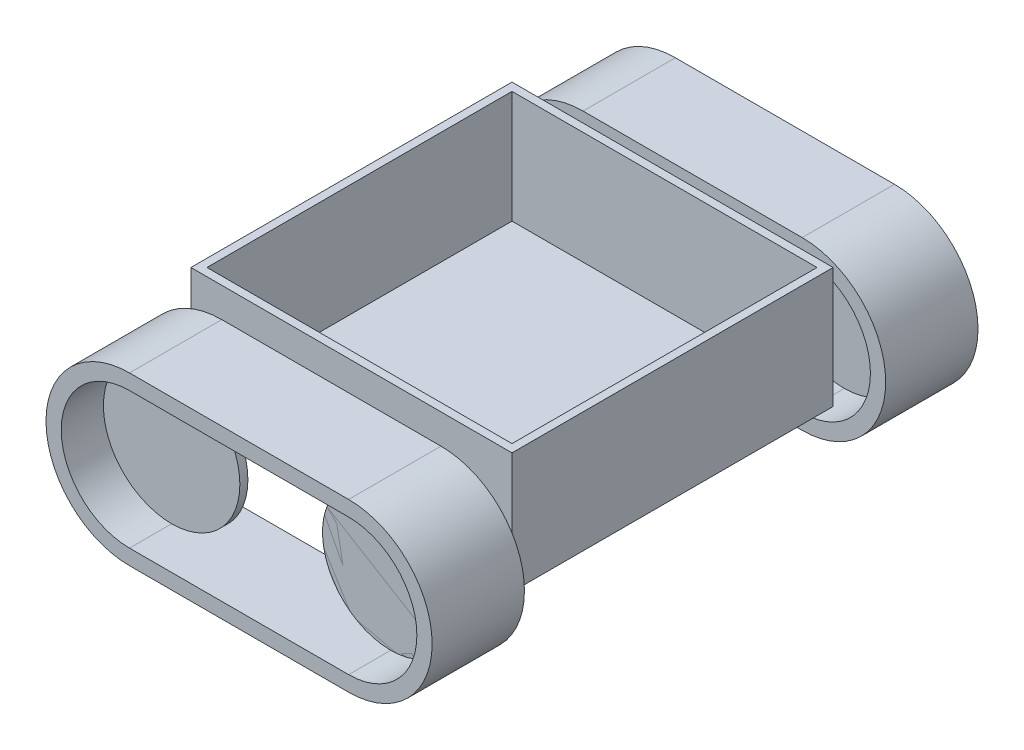
from build123d import *

# Parameters (mm, degrees)
SCHIZZO1_R                     = 85
ESTRUSIONE_ESTRUSIONE1_DEPTH   = 10
ESTRUSIONE_ESTRUSIONE1_2_DEPTH = 10
ESTRUSIONE_SOTTILE1_START      = -62.5
ESTRUSIONE_SOTTILE1_DEPTH      = 115
SCHIZZO3_W                     = 400
SCHIZZO3_H                     = 150
ESTRUSIONE_ESTRUSIONE2_DEPTH   = 400
SVUOTA1_T                      = -10
RIPETIZIONE_START              = 565
RIPETIZIONE_A_L2_OUTLINE_R     = 85
RIPETIZIONE_A_L2_DEPTH         = 10
RIPETIZIONE_START_2            = 512.5
RIPETIZIONE_A_L2_2_DEPTH       = 115
RIPETIZIONE_A_L2_3_OUTLINE_R   = 85
RIPETIZIONE_A_L2_3_DEPTH       = 10


# Read off the part's stored shape, not the designer's step: Ripetizione a L2
with BuildPart() as part:
    # Schizzo1 → Estrusione-Estrusione1 (new body)
    with BuildSketch(Plane.XY):
        with Locations((-136.5, 0)):
            Circle(SCHIZZO1_R)
    extrude(amount=ESTRUSIONE_ESTRUSIONE1_DEPTH)



with BuildPart() as body_2:
    # Schizzo1 → Estrusione-Estrusione1 2 (new body)
    with BuildSketch(Plane.XY):
        with Locations((136.5, 0)):
            Circle(SCHIZZO1_R)
    extrude(amount=ESTRUSIONE_ESTRUSIONE1_2_DEPTH)


with BuildPart() as part_1:
    add(part.part)

    add(body_2.part)  # Estrusione-Sottile1 merges body 2
    # Schizzo2 → Estrusione-Sottile1 (add)
    with BuildSketch(Plane.XY.offset(10).offset(ESTRUSIONE_SOTTILE1_START)):
        with BuildLine():
            Line((136.5, 104), (-136.5, 104))
            ThreePointArc((-136.5, 104), (-240.5, 0), (-136.5, -104))
            Line((-136.5, -104), (136.5, -104))
            ThreePointArc((136.5, -104), (240.5, 0), (136.5, 104))
        make_face()
        with BuildLine():
            Line((136.5, 85), (-136.5, 85))
            ThreePointArc((-136.5, 85), (-221.5, 0), (-136.5, -85))
            Line((-136.5, -85), (136.5, -85))
            ThreePointArc((136.5, -85), (221.5, 0), (136.5, 85))
        make_face(mode=Mode.SUBTRACT)
    extrude(amount=ESTRUSIONE_SOTTILE1_DEPTH)


with BuildPart() as body_2_2:
    # Schizzo3 → Estrusione-Estrusione2 (new body)
    with BuildSketch(Plane.XY.offset(87.5)):
        with Locations((0, 41)):
            Rectangle(SCHIZZO3_W, SCHIZZO3_H)
    extrude(amount=ESTRUSIONE_ESTRUSIONE2_DEPTH)

    # Svuota1
    svuota1_openings = [body_2_2.faces().sort_by_distance(p)[0] for p in [
        (0, 116, 287.5),
    ]]
    offset(amount=SVUOTA1_T, openings=svuota1_openings, kind=Kind.INTERSECTION)


with BuildPart() as body_3:
    # Ripetizione a L2 outline → Ripetizione a L2 (new body)
    with BuildSketch(Plane.XY.offset(RIPETIZIONE_START)):
        with Locations((136.5, 0)):
            Circle(RIPETIZIONE_A_L2_OUTLINE_R)
    extrude(amount=RIPETIZIONE_A_L2_DEPTH)


with BuildPart() as body_4:
    # Ripetizione a L2 2 outline → Ripetizione a L2 2 (new body)
    with BuildSketch(Plane.XY.offset(RIPETIZIONE_START_2)):
        with BuildLine():
            ThreePointArc((-136.5, 104), (-240.5, 0), (-136.5, -104))
            Line((-136.5, -104), (136.5, -104))
            ThreePointArc((136.5, -104), (240.5, 0), (136.5, 104))
            Line((136.5, 104), (-136.5, 104))
        make_face()
        with BuildLine():
            Line((-136.5, 85), (136.5, 85))
            ThreePointArc((136.5, 85), (221.5, 0), (136.5, -85))
            Line((136.5, -85), (-136.5, -85))
            ThreePointArc((-136.5, -85), (-221.5, 0), (-136.5, 85))
        make_face(mode=Mode.SUBTRACT)
    extrude(amount=RIPETIZIONE_A_L2_2_DEPTH)

    # Ripetizione a L2 3 outline → Ripetizione a L2 3 (add)
    with BuildSketch(Plane.XY.offset(RIPETIZIONE_START)):
        with Locations((136.5, 0)):
            Circle(RIPETIZIONE_A_L2_3_OUTLINE_R)
        with Locations((-136.5, 0)):
            Circle(RIPETIZIONE_A_L2_3_OUTLINE_R)
    extrude(amount=RIPETIZIONE_A_L2_3_DEPTH)


solid = Compound([part_1.part, body_2_2.part, body_3.part, body_4.part])
